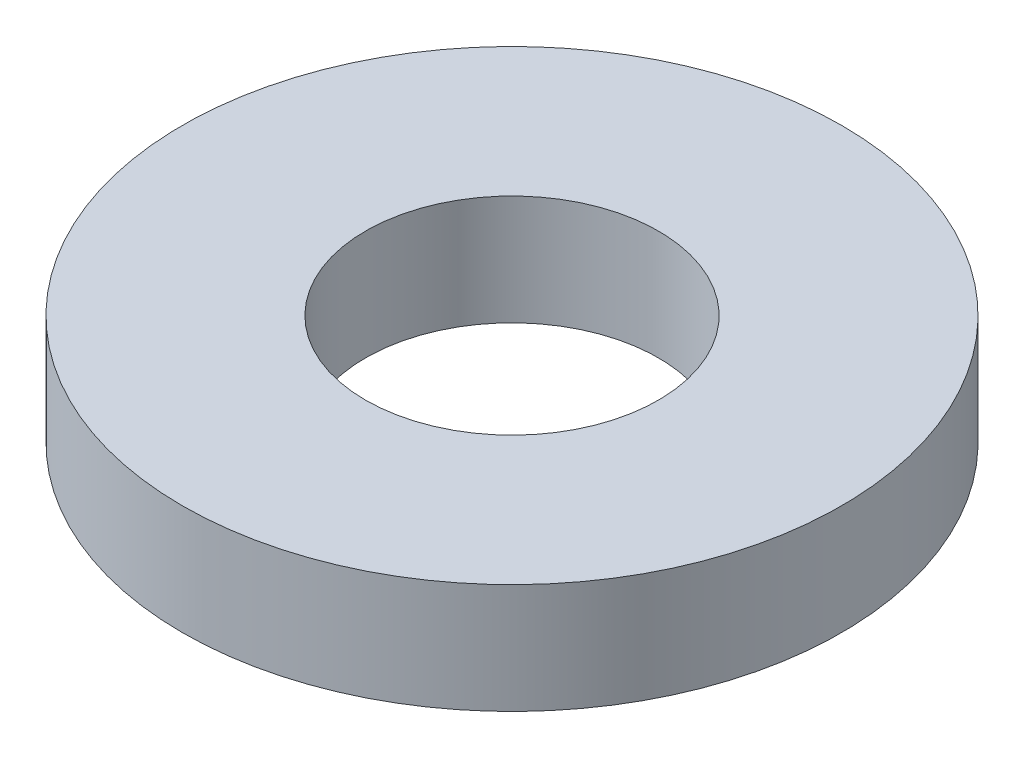
from build123d import *

# Parameters (mm, degrees)
SKETCH1_R           = 90
BOSS_EXTRUDE1_DEPTH = 30
SKETCH2_R           = 40
CUT_EXTRUDE1_DEPTH  = 131.766968306


with BuildPart() as part:
    # Sketch1 → Boss-Extrude1 (new body)
    with BuildSketch(Plane(origin=(0, 0, 0), x_dir=(1, 0, 0), z_dir=(0, 1, 0))):
        Circle(SKETCH1_R)
    extrude(amount=BOSS_EXTRUDE1_DEPTH)

    # Sketch2 → Cut-Extrude1 (cut, through all)
    with BuildSketch(Plane(origin=(0, 0, 0), x_dir=(1, 0, 0), z_dir=(0, 1, 0))):
        Circle(SKETCH2_R)
    extrude(amount=CUT_EXTRUDE1_DEPTH, mode=Mode.SUBTRACT)


solid = part.part
